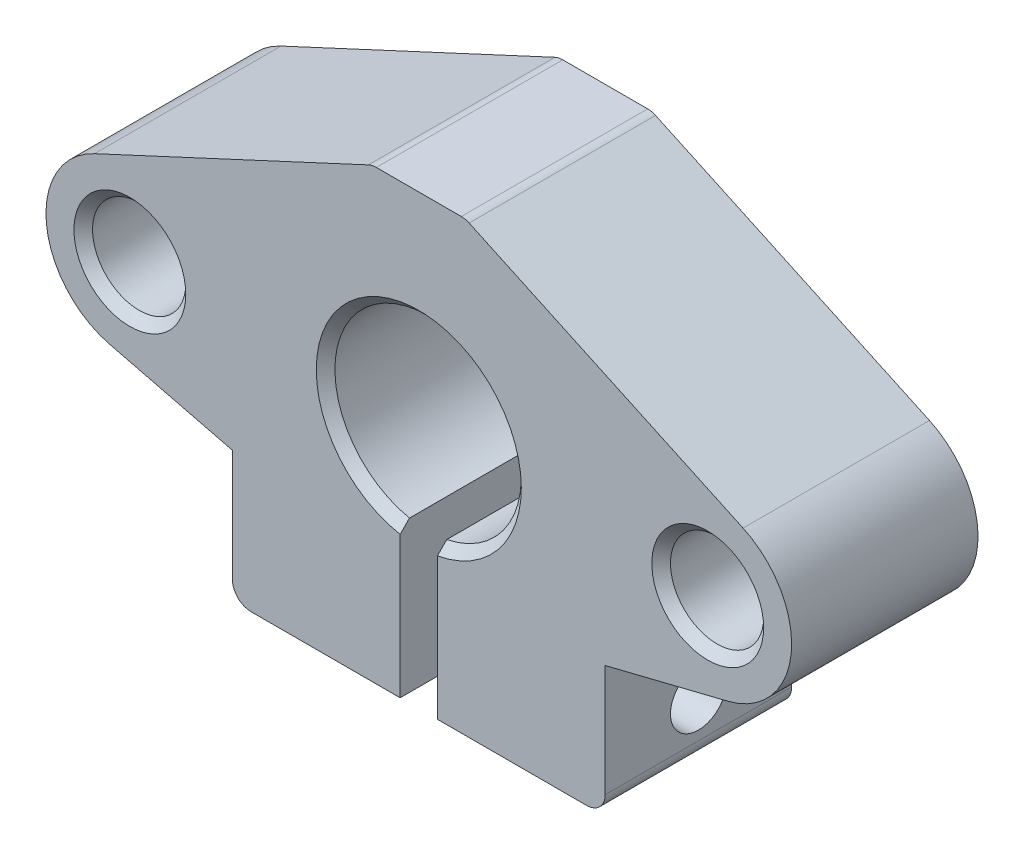
from build123d import *
from build123d.topology import SkipClean

# Parameters (mm, degrees)
SKETCH_1_R          = 2.5
EXTRUDE_1_DEPTH     = 10
SKETCH_2_W          = 2
SKETCH_2_H          = 10
CUT_EXTRUDE_1_DEPTH = 10
SKETCH_3_R          = 1.5
CUT_EXTRUDE_2_DEPTH = 40.698866483
CHAMFER_1_SIZE      = 0.5
FILLET_1_R          = 1


with BuildPart() as part:
    # 草图1 → 凸台-拉伸1 (new body)
    with BuildSketch(Plane.XY):
        with BuildLine():
            Line((0, 0), (0, 8))
            ThreePointArc((0, 8), (-5, 13), (0, 18))
            Line((0, 18), (0, 24))
            Line((0, 24), (-2.5, 24))
            Line((-2.5, 24), (-17.395659833, 17.081234348))
            ThreePointArc((-17.395659833, 17.081234348), (-19.979326925, 12.569151657), (-16.582987314, 8.632261629))
            Line((-16.582987314, 8.632261629), (-10, 7))
            Line((-10, 7), (-10, 0))
            Line((-10, 0), (0, 0))
        make_face()
        with Locations((-15.5, 13)):
            Circle(SKETCH_1_R, mode=Mode.SUBTRACT)
    extrude_1 = extrude(amount=EXTRUDE_1_DEPTH)

    # 镜向1: 凸台-拉伸1 across plane
    with SkipClean():  # the faces are left unmerged after this step: merging them gives an invalid solid
        add(extrude_1.mirror(Plane(origin=(0, 18, 10), x_dir=(0, 0, 1), z_dir=(-1, 0, 0))))

    # 草图2 → 切除-拉伸1 (cut)
    with BuildSketch(Plane.XZ):
        with Locations((0, 5)):
            Rectangle(SKETCH_2_W, SKETCH_2_H)
    extrude(amount=-CUT_EXTRUDE_1_DEPTH, mode=Mode.SUBTRACT)

    # 草图3 → 切除-拉伸2 (cut, through all)
    with BuildSketch(Plane(origin=(10, 0, 0), x_dir=(0, 0, -1), z_dir=(1, 0, 0))):
        with Locations((-5, 3)):
            Circle(SKETCH_3_R)
    extrude(amount=-CUT_EXTRUDE_2_DEPTH, mode=Mode.SUBTRACT)

    # 倒角1
    chamfer_1_edges = [part.edges().sort_by_distance(p)[0] for p in [
        (-18, 13, 0),
        (-18, 13, 10),
        (18, 13, 10),
        (18, 13, 0),
        (0, 18, 0),
        (0, 18, 10),
        (-10, 3, 6.5),
    ]]
    chamfer(chamfer_1_edges, length=CHAMFER_1_SIZE)

    # 圆角1
    fillet_1_edges = [part.edges().sort_by_distance(p)[0] for p in [
        (-10, 0, 5),
        (-2.5, 24, 5),
        (10, 0, 5),
        (2.5, 24, 5),
    ]]
    fillet(fillet_1_edges, radius=FILLET_1_R - 0.0001)  # a hair under: the kernel refuses the full size


solid = part.part
